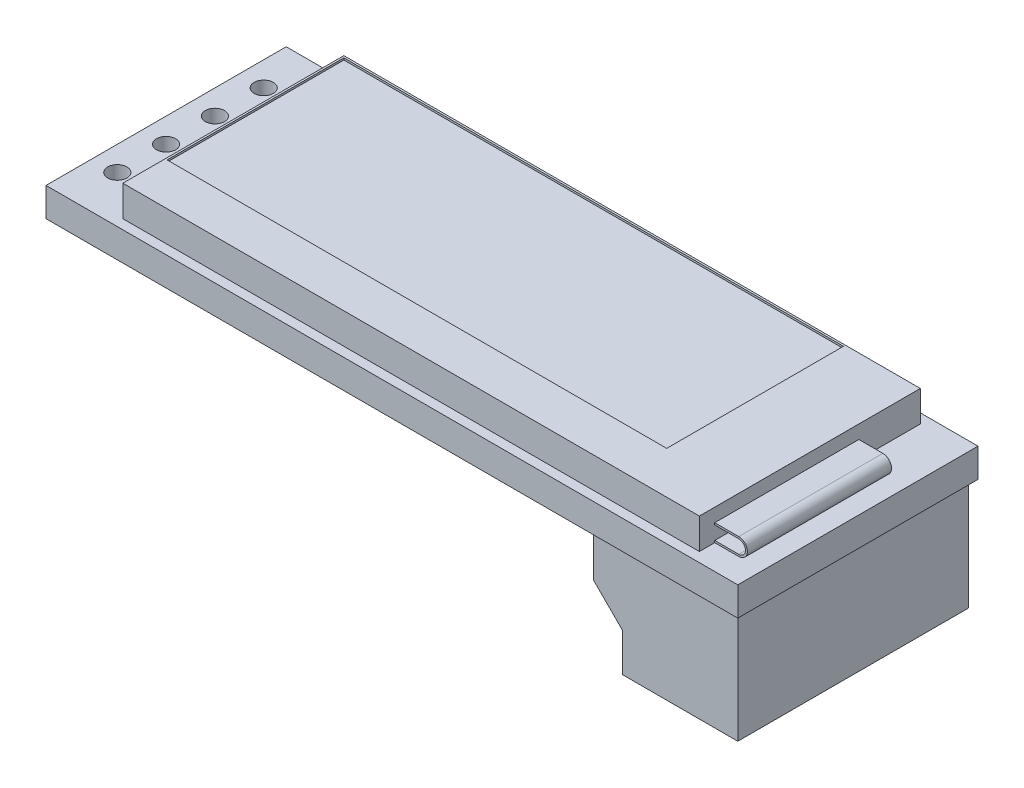
from build123d import *

# Parameters (mm, degrees)
SKETCH1_W           = 36
SKETCH1_H           = 12.5
BOSS_EXTRUDE1_DEPTH = 1.5
SKETCH2_R           = 0.5
CUT_EXTRUDE1_DEPTH  = 20.113149924
LPATTERN1_COUNT     = 4
LPATTERN1_PITCH     = 2.54
SKETCH3_W           = 7.5
SKETCH3_H           = 12
BOSS_EXTRUDE2_DEPTH = 5.8
SKETCH4_W           = 1.5
SKETCH4_H           = 2
CUT_EXTRUDE2_DEPTH  = 23.532254659
CHAMFER1_SIZE       = 1.5
SKETCH5_W           = 30
SKETCH5_H           = 11.5
BOSS_EXTRUDE3_DEPTH = 1.6
EXTRUDE_THIN1_START = -0.8
EXTRUDE_THIN1_DEPTH = 7.5
SKETCH7_W           = 26
SKETCH7_H           = 9.2
CUT_EXTRUDE3_DEPTH  = 0.1


with BuildPart() as part:
    # Sketch1 → Boss-Extrude1 (new body)
    with BuildSketch(Plane(origin=(0, 0, 0), x_dir=(1, 0, 0), z_dir=(0, 1, 0))):
        Rectangle(SKETCH1_W, SKETCH1_H)
    extrude(amount=BOSS_EXTRUDE1_DEPTH)

    # Sketch2 → Cut-Extrude1 (cut, through all)
    with BuildSketch(Plane(origin=(0, 1.5, 0), x_dir=(1, 0, 0), z_dir=(0, 1, 0))):
        with Locations(Location((-16.73, -3.81, 0), (0, 0, 270))):
            Circle(SKETCH2_R)
    cut_extrude1 = extrude(amount=-CUT_EXTRUDE1_DEPTH, mode=Mode.SUBTRACT)

    # LPattern1: Cut-Extrude1 ×4
    with Locations(*[(0, 0, -i * LPATTERN1_PITCH) for i in range(1, LPATTERN1_COUNT)]):
        add(cut_extrude1, mode=Mode.SUBTRACT)

    # Sketch3 → Boss-Extrude2 (add)
    with BuildSketch(Plane.XZ):
        with Locations((14, 0)):
            Rectangle(SKETCH3_W, SKETCH3_H)
    extrude(amount=BOSS_EXTRUDE2_DEPTH)

    # Sketch4 → Cut-Extrude2 (cut, through all)
    with BuildSketch(Plane.XY.offset(6)):
        with Locations((11, -4.8)):
            Rectangle(SKETCH4_W, SKETCH4_H)
    extrude(amount=-CUT_EXTRUDE2_DEPTH, mode=Mode.SUBTRACT)

    # Chamfer1
    chamfer1_edges = [part.edges().sort_by_distance(p)[0] for p in [
        (10.25, -3.8, 0),
    ]]
    chamfer(chamfer1_edges, length=CHAMFER1_SIZE - 0.0001)  # a hair under: the kernel refuses the full size

    # Sketch5 → Boss-Extrude3 (add)
    with BuildSketch(Plane(origin=(0, 1.5, 0), x_dir=(1, 0, 0), z_dir=(0, 1, 0))):
        with Locations((0.5, 0)):
            Rectangle(SKETCH5_W, SKETCH5_H)
    extrude(amount=BOSS_EXTRUDE3_DEPTH)

    # Sketch6 → Extrude-Thin1 (add)
    with BuildSketch(Plane.XY.offset(5.75).offset(EXTRUDE_THIN1_START)):
        with BuildLine():
            Line((15.5, 1.5), (16.75, 1.5))
            ThreePointArc((16.75, 1.5), (17.2, 1.95), (16.75, 2.4))
            Line((16.75, 2.4), (15.5, 2.4))
            Line((15.5, 2.4), (15.5, 2.3))
            Line((15.5, 2.3), (16.75, 2.3))
            ThreePointArc((16.75, 2.3), (17.1, 1.95), (16.75, 1.6))
            Line((16.75, 1.6), (15.5, 1.6))
            Line((15.5, 1.6), (15.5, 1.5))
        make_face()
    extrude(amount=-EXTRUDE_THIN1_DEPTH)

    # Sketch7 → Cut-Extrude3 (cut)
    with BuildSketch(Plane(origin=(0, 3.1, 0), x_dir=(1, 0, 0), z_dir=(0, 1, 0))):
        with Locations((-1.4, 1.05)):
            Rectangle(SKETCH7_W, SKETCH7_H)
    extrude(amount=-CUT_EXTRUDE3_DEPTH, mode=Mode.SUBTRACT)


solid = part.part
